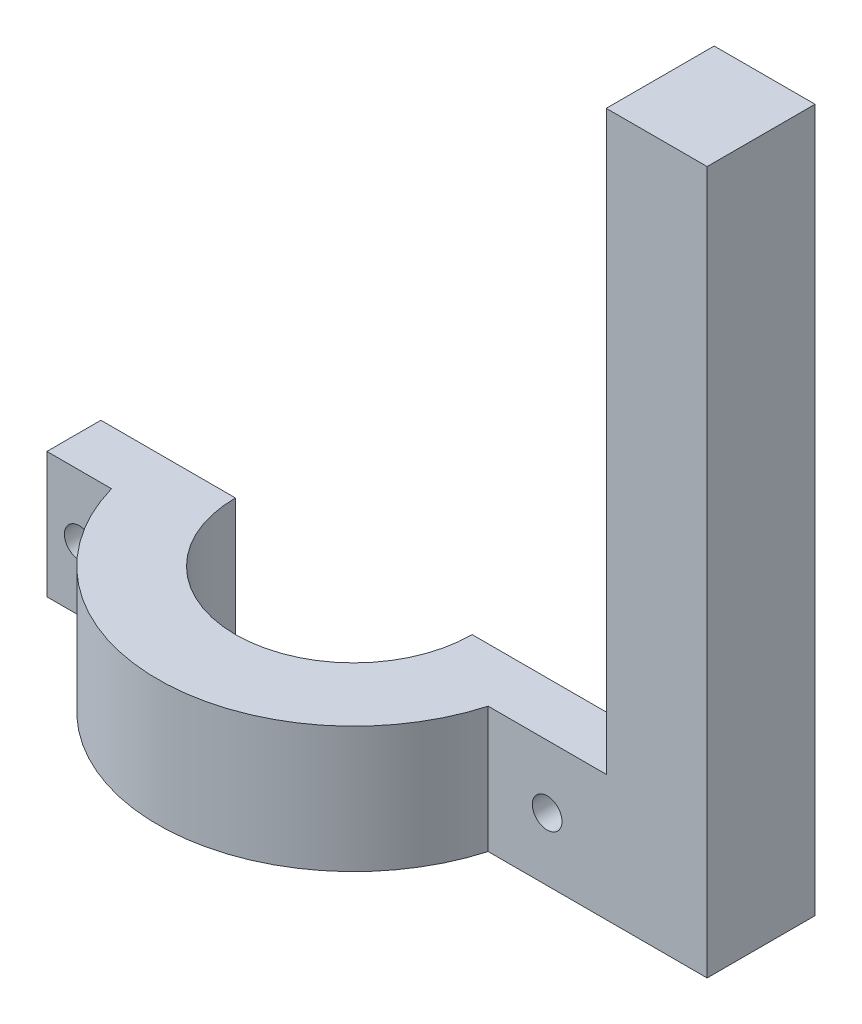
from build123d import *

# Parameters (mm, degrees)
SKETCH_1_W                = 50.28
SKETCH_1_H                = 34.2
SKETCH_1_W_2              = 30.28
SKETCH_1_H_2              = 14.2
EXTRUDE_1_DEPTH           = 12.25
SKETCH_4_W                = 13
SKETCH_4_H                = 13.91
EXTRUDE_1_2_DEPTH         = 74.82
SKETCH_5_W                = 13.91
SKETCH_5_H                = 16.23
EXTRUDE_2_DEPTH           = 16
SKETCH_7_R                = 25.25
SKETCH_7_R_2              = 15.25
EXTRUDE_2_2_DEPTH         = 16.23
SKETCH_15_R               = 1.91
CUT_EXTRUDE_6_DEPTH       = 97.964478439
SKETCH_18_W               = 49.344544624
SKETCH_18_H               = 6.125
CUT_EXTRUDE_8_DEPTH       = 101.789238284
SKETCH_19_W               = 34.2
SKETCH_19_H               = 6.125
CUT_EXTRUDE_9_DEPTH       = 10
SKETCH_21_R               = 1.91
CUT_EXTRUDE_10_DEPTH      = 10
SKETCH_20_R               = 1.91
CUT_EXTRUDE_11_DEPTH      = 10
FILLET_START              = -7.1
FILLET_1_DEPTH            = 14.2
FILLET_2_DEPTH            = 14.2
SKETCH_29_W               = 13.91
SKETCH_29_H               = 74.82
EXTRUDE_5_DEPTH           = 10
SKETCH_30_W               = 10
SKETCH_30_H               = 58.59
CUT_EXTRUDE_13_DEPTH      = 97.964478439
SKETCH_32_W               = 34.2
SKETCH_32_H               = 5.745736365
EXTRUDE_6_DEPTH           = 10
CUT_EXTRUDE_16_DEPTH      = 50
CUT_EXTRUDE_16_DEPTH_BACK = 50
SKETCH_38_W               = 116.985630298
SKETCH_38_H               = 80.538350638
SKETCH_41_W               = 13.91
SKETCH_41_H               = 5.745736365
EXTRUDE_7_DEPTH           = 3
SKETCH_42_W               = 13
SKETCH_42_H               = 13.91
EXTRUDE_8_DEPTH           = 74.82
SKETCH_43_W               = 13.91
SKETCH_43_H               = 16.23
EXTRUDE_9_DEPTH           = 15.22
SKETCH_44_R               = 1.91
CUT_EXTRUDE_17_DEPTH      = 15.22
SKETCH_46_R               = 25.25
SKETCH_46_R_2             = 15.25
EXTRUDE_6_2_DEPTH         = 16.23
EXTRUDE_10_DEPTH          = 7.22
EXTRUDE_10_DEPTH_BACK     = 10
SKETCH_47_W               = 13.91
SKETCH_47_H               = 16.23
SKETCH_50_W               = 3.056753925
SKETCH_50_H               = 16.23
CUT_EXTRUDE_18_DEPTH      = 96.578211037
SKETCH_51_R               = 1.91
CUT_EXTRUDE_19_DEPTH      = 95.015226304
SKETCH_52_W               = 92.841945613
SKETCH_52_H               = 30
CUT_EXTRUDE_20_DEPTH      = 84.840694713
CUT_EXTRUDE_22_DEPTH      = 50
CUT_EXTRUDE_22_DEPTH_BACK = 50
SKETCH_53_W               = 63.541345486
SKETCH_53_H               = 14.170740414
SKETCH_54_W               = 10
SKETCH_54_H               = 10.145
CUT_EXTRUDE_23_DEPTH      = 50
SKETCH_55_W               = 13
SKETCH_55_H               = 13.91
EXTRUDE_11_DEPTH          = 10
SKETCH_57_W               = 15
SKETCH_57_H               = 34.2
EXTRUDE_12_DEPTH          = 10
SKETCH_58_W               = 34.2
SKETCH_58_H               = 10
EXTRUDE_13_DEPTH          = 27.85
SKETCH_60_W               = 34.2
SKETCH_60_H               = 10
EXTRUDE_14_DEPTH          = 50.28
SKETCH_62_W               = 30.28
SKETCH_62_H               = 14.2
CUT_EXTRUDE_24_DEPTH      = 50.28
SKETCH_64_R               = 1.91
CUT_EXTRUDE_25_DEPTH      = 10
FILLET_3_R                = 30
SKETCH_71_W               = 129.242048602
SKETCH_71_H               = 16.62743132
CUT_EXTRUDE_26_DEPTH      = 88


with BuildPart() as part:
    # 草圖1 → Extrude 1 (new body)
    with BuildSketch(Plane(origin=(0, 0, 0), x_dir=(1, 0, 0), z_dir=(0, 1, 0))):
        Rectangle(SKETCH_1_W, SKETCH_1_H)
        Rectangle(SKETCH_1_W_2, SKETCH_1_H_2, mode=Mode.SUBTRACT)
    extrude(amount=EXTRUDE_1_DEPTH)

    # 草圖4 → Extrude 1 2 (add)
    with BuildSketch(Plane.XZ):
        with Locations((18.64, 0)):
            Rectangle(SKETCH_4_W, SKETCH_4_H)
    extrude(amount=EXTRUDE_1_2_DEPTH)

    # 草圖5 → Extrude 2 (add)
    with BuildSketch(Plane.ZY.offset(-12.14)):
        with Locations((0, -66.705)):
            Rectangle(SKETCH_5_W, SKETCH_5_H)
    extrude(amount=EXTRUDE_2_DEPTH)

    # 草圖7 → Extrude 2 2 (add)
    with BuildSketch(Plane(origin=(3.626674765, -74.82, 0), x_dir=(1, 0, 0), z_dir=(0, -1, 0))):
        with Locations((-30.978154344, 0)):
            Circle(SKETCH_7_R)
        with Locations((-30.978154344, 0)):
            Circle(SKETCH_7_R_2, mode=Mode.SUBTRACT)
    extrude(amount=-EXTRUDE_2_2_DEPTH)

    # 草圖15 → 除料-伸長6 (cut, through all)
    with BuildSketch(Plane(origin=(0, 0, -6.955), x_dir=(-1, 0, 0), z_dir=(0, 0, -1))):
        with Locations((-4.530883248, -66.705)):
            Circle(SKETCH_15_R)
    extrude(amount=-CUT_EXTRUDE_6_DEPTH, mode=Mode.SUBTRACT)

    # 草圖18 → 除料-伸長8 (cut, through all)
    with BuildSketch(Plane(origin=(0, 0, -17.1), x_dir=(-1, 0, 0), z_dir=(0, 0, -1))):
        with Locations((0.467727688, 9.1875)):
            Rectangle(SKETCH_18_W, SKETCH_18_H)
    extrude(amount=-CUT_EXTRUDE_8_DEPTH, mode=Mode.SUBTRACT)

    # 草圖19 → 除料-伸長9 (cut)
    with BuildSketch(Plane.ZY.offset(-24.204544624)):
        with Locations((0, 9.1875)):
            Rectangle(SKETCH_19_W, SKETCH_19_H)
    extrude(amount=-CUT_EXTRUDE_9_DEPTH, mode=Mode.SUBTRACT)

    # 草圖21 → 除料-伸長10 (cut)
    with BuildSketch(Plane(origin=(0, 6.125, 0), x_dir=(1, 0, 0), z_dir=(0, 1, 0))):
        with Locations(Location((17.69, 0, 0), (0, 0, 270))):
            Circle(SKETCH_21_R)
    extrude(amount=-CUT_EXTRUDE_10_DEPTH, mode=Mode.SUBTRACT)

    # 草圖20 → 除料-伸長11 (cut)
    with BuildSketch(Plane(origin=(0, 6.125, 0), x_dir=(1, 0, 0), z_dir=(0, 1, 0))):
        with Locations(Location((-17.395, 0, 0), (0, 0, 270))):
            Circle(SKETCH_20_R)
    extrude(amount=-CUT_EXTRUDE_11_DEPTH, mode=Mode.SUBTRACT)

    # 圓角1: read off the stored shape, not the designer's step
    # 圓角1 outline → 圓角1 (cut)
    with BuildSketch(Plane.XY.offset(FILLET_START)):
        with BuildLine():
            add(Edge.make_bspline(
                [(-15.14, 0), (-21.974170252, 5.199829476), (-25.14, 5.745736365)],
                knots=[0, 0, 0, 0.664102345, 0.664102345, 0.664102345], degree=2, weights=[1, 2.223777218, 1.822127795]))
            Line((-15.14, 0), (-15.14, 6.125))
            Line((-15.14, 6.125), (-25.14, 6.125))
            Line((-25.14, 6.125), (-25.14, 5.745736365))
        make_face()
    extrude(amount=FILLET_1_DEPTH, mode=Mode.SUBTRACT)

    # 圓角2: read off the stored shape, not the designer's step
    # 圓角2 outline → 圓角2 (cut)
    with BuildSketch(Plane.XY.offset(FILLET_START)):
        with BuildLine():
            Line((15.14, 6.125), (15.14, 0))
            add(Edge.make_bspline(
                [(15.14, 0), (21.974170252, 5.199829476), (25.14, 5.745736365)],
                knots=[0, 0, 0, 0.664102345, 0.664102345, 0.664102345], degree=2, weights=[1, 2.223777218, 1.822127795]))
            Line((25.14, 5.745736365), (25.14, 6.125))
            Line((25.14, 6.125), (15.14, 6.125))
        make_face()
    extrude(amount=FILLET_2_DEPTH, mode=Mode.SUBTRACT)

    # 草圖29 → 填料-伸長5 (add)
    with BuildSketch(Plane(origin=(25.14, 0, 0), x_dir=(0, 0, -1), z_dir=(1, 0, 0))):
        with Locations((0, -37.41)):
            Rectangle(SKETCH_29_W, SKETCH_29_H)
    extrude(amount=EXTRUDE_5_DEPTH)

    # 草圖30 → 除料-伸長13 (cut, through all)
    with BuildSketch(Plane.XY.offset(6.955)):
        with Locations((17.14, -29.295)):
            Rectangle(SKETCH_30_W, SKETCH_30_H)
    extrude(amount=-CUT_EXTRUDE_13_DEPTH, mode=Mode.SUBTRACT)

    # 草圖32 → Extrude 6 (add)
    with BuildSketch(Plane(origin=(25.14, 0, 0), x_dir=(0, 0, -1), z_dir=(1, 0, 0))):
        with Locations((0, 2.872868182)):
            Rectangle(SKETCH_32_W, SKETCH_32_H)
    extrude(amount=EXTRUDE_6_DEPTH)

    # 草圖38 → 除料-伸長16 (cut, two sides: drawn at the far end of the back side and taken through both)
    with BuildSketch(Plane(origin=(0, 0, -6.955), x_dir=(-1, 0, 0), z_dir=(0, 0, -1)).offset(-CUT_EXTRUDE_16_DEPTH_BACK)):
        with Locations((7.268869252, -40.269175319)):
            Rectangle(SKETCH_38_W, SKETCH_38_H)
    extrude(amount=CUT_EXTRUDE_16_DEPTH + CUT_EXTRUDE_16_DEPTH_BACK, mode=Mode.SUBTRACT)

    # 草圖41 → 填料-伸長7 (add)
    with BuildSketch(Plane(origin=(35.14, 0, 0), x_dir=(0, 0, -1), z_dir=(1, 0, 0))):
        with Locations((0, 2.872868182)):
            Rectangle(SKETCH_41_W, SKETCH_41_H)
    extrude(amount=EXTRUDE_7_DEPTH)

    # 草圖42 → 填料-伸長8 (add)
    with BuildSketch(Plane(origin=(0, 0, 0), x_dir=(-1, 0, 0), z_dir=(0, -1, 0))):
        with Locations((-31.64, 0)):
            Rectangle(SKETCH_42_W, SKETCH_42_H)
    extrude(amount=EXTRUDE_8_DEPTH)

    # 草圖43 → 填料-伸長9 (add)
    with BuildSketch(Plane.ZY.offset(-25.14)):
        with Locations((0, -66.705)):
            Rectangle(SKETCH_43_W, SKETCH_43_H)
    extrude(amount=EXTRUDE_9_DEPTH)

    # 草圖44 → 除料-伸長17 (cut)
    with BuildSketch(Plane(origin=(0, 0, -6.955), x_dir=(-1, 0, 0), z_dir=(0, 0, -1))):
        with Locations(Location((-17.524895264, -66.705, 0), (0, 0, 90))):
            Circle(SKETCH_44_R)
    extrude(amount=-CUT_EXTRUDE_17_DEPTH, mode=Mode.SUBTRACT)

    # 草圖46 → Extrude 6 2 (add)
    with BuildSketch(Plane(origin=(0, -58.59, 0), x_dir=(1, 0, 0), z_dir=(0, 1, 0))):
        with Locations((-14.35, 0)):
            Circle(SKETCH_46_R)
        with Locations((-14.35, 0)):
            Circle(SKETCH_46_R_2, mode=Mode.SUBTRACT)
    extrude(amount=-EXTRUDE_6_2_DEPTH)

    # 草圖47 → 填料-伸長10 (add, two sides: drawn at the far end of the back side and taken through both)
    with BuildSketch(Plane(origin=(-40, 0, 0), x_dir=(0, 0, -1), z_dir=(1, 0, 0)).offset(-EXTRUDE_10_DEPTH_BACK)):
        with Locations((0, -66.705)):
            Rectangle(SKETCH_47_W, SKETCH_47_H)
    extrude(amount=EXTRUDE_10_DEPTH + EXTRUDE_10_DEPTH_BACK)

    # 草圖50 → 除料-伸長18 (cut, through all)
    with BuildSketch(Plane(origin=(0, 0, -6.955), x_dir=(-1, 0, 0), z_dir=(0, 0, -1))):
        with Locations((48.471623038, -66.705)):
            Rectangle(SKETCH_50_W, SKETCH_50_H)
    extrude(amount=-CUT_EXTRUDE_18_DEPTH, mode=Mode.SUBTRACT)

    # 草圖51 → 除料-伸長19 (cut, through all)
    with BuildSketch(Plane(origin=(0, 0, -6.955), x_dir=(-1, 0, 0), z_dir=(0, 0, -1))):
        with Locations((42.786508152, -66.705)):
            Circle(SKETCH_51_R)
    extrude(amount=-CUT_EXTRUDE_19_DEPTH, mode=Mode.SUBTRACT)

    # 草圖52 → 除料-伸長20 (cut, through all)
    with BuildSketch(Plane(origin=(0, -58.59, 0), x_dir=(1, 0, 0), z_dir=(0, 1, 0))):
        with Locations((-21.280972807, 15)):
            Rectangle(SKETCH_52_W, SKETCH_52_H)
    extrude(amount=-CUT_EXTRUDE_20_DEPTH, mode=Mode.SUBTRACT)

    # 草圖53 → 除料-伸長22 (cut, two sides: drawn at the far end of the back side and taken through both)
    with BuildSketch(Plane(origin=(0, 0, -6.955), x_dir=(-1, 0, 0), z_dir=(0, 0, -1)).offset(-CUT_EXTRUDE_22_DEPTH_BACK)):
        with Locations((6.630672743, -0.960370207)):
            Rectangle(SKETCH_53_W, SKETCH_53_H)
    extrude(amount=CUT_EXTRUDE_22_DEPTH + CUT_EXTRUDE_22_DEPTH_BACK, mode=Mode.SUBTRACT)

    # 草圖54 → 除料-伸長23 (cut)
    with BuildSketch(Plane(origin=(0, 5.745736365, 0), x_dir=(1, 0, 0), z_dir=(0, 1, 0))):
        with Locations((30.14, -12.0275)):
            Rectangle(SKETCH_54_W, SKETCH_54_H)
        with Locations((30.14, 12.0275)):
            Rectangle(SKETCH_54_W, SKETCH_54_H)
    extrude(amount=-CUT_EXTRUDE_23_DEPTH, mode=Mode.SUBTRACT)

    # 草圖55 → 填料-伸長11 (add)
    with BuildSketch(Plane(origin=(0, 5.745736365, 0), x_dir=(1, 0, 0), z_dir=(0, 1, 0))):
        with Locations((31.64, 0)):
            Rectangle(SKETCH_55_W, SKETCH_55_H)
    extrude(amount=EXTRUDE_11_DEPTH)

    # 草圖57 → 填料-伸長12 (add)
    with BuildSketch(Plane(origin=(0, 15.745736365, 0), x_dir=(1, 0, 0), z_dir=(0, 1, 0))):
        with Locations((31.64, 0)):
            Rectangle(SKETCH_57_W, SKETCH_57_H)
    extrude(amount=EXTRUDE_12_DEPTH)

    # 草圖58 → 填料-伸長13 (add)
    with BuildSketch(Plane.ZY.offset(-24.14)):
        with Locations((0, 20.745736365)):
            Rectangle(SKETCH_58_W, SKETCH_58_H)
    extrude(amount=EXTRUDE_13_DEPTH)

    # 草圖60 → 填料-伸長14 (add)
    with BuildSketch(Plane.ZY.offset(3.71)):
        with Locations((0, 20.745736365)):
            Rectangle(SKETCH_60_W, SKETCH_60_H)
    extrude(amount=EXTRUDE_14_DEPTH)

    # 草圖62 → 除料-伸長24 (cut)
    with BuildSketch(Plane(origin=(0, 25.745736365, 0), x_dir=(1, 0, 0), z_dir=(0, 1, 0))):
        with Locations((-28.85, 0)):
            Rectangle(SKETCH_62_W, SKETCH_62_H)
    extrude(amount=-CUT_EXTRUDE_24_DEPTH, mode=Mode.SUBTRACT)

    # 草圖64 → 除料-伸長25 (cut)
    with BuildSketch(Plane(origin=(0, 25.745736365, 0), x_dir=(1, 0, 0), z_dir=(0, 1, 0))):
        with Locations(Location((-8.71, 0, 0), (0, 0, 270))):
            Circle(SKETCH_64_R)
        with Locations(Location((-48.99, 0, 0), (0, 0, 270))):
            Circle(SKETCH_64_R)
    extrude(amount=-CUT_EXTRUDE_25_DEPTH, mode=Mode.SUBTRACT)

    # 圓角3
    # the kernel refuses this fillet: 30 mm, written as the material it takes off along each edge
    with BuildSketch(Plane(origin=(-43.99, 25.745736365, 7.1), x_dir=(-1, 0, 0), z_dir=(0, 0, -1)), Plane(origin=(-13.71, 25.745736365, -7.1), x_dir=(1, 0, 0), z_dir=(0, 0, 1))) as fillet_3_piece_1:
        with BuildLine():
            CenterArc((22.360679775, -30), FILLET_3_R, 90, 48.189685104)
            Line((0, -10), (0, 0))
            Line((0, 0), (22.360679775, 0))
        make_face()
    extrude(amount=14.2, mode=Mode.SUBTRACT)

    # 草圖71 → 除料-伸長26 (cut)
    with BuildSketch(Plane(origin=(0, 0, -17.1), x_dir=(-1, 0, 0), z_dir=(0, 0, -1))):
        with Locations((25.481024301, 24.059452025)):
            Rectangle(SKETCH_71_W, SKETCH_71_H)
    extrude(amount=-CUT_EXTRUDE_26_DEPTH, mode=Mode.SUBTRACT)


solid = part.part
